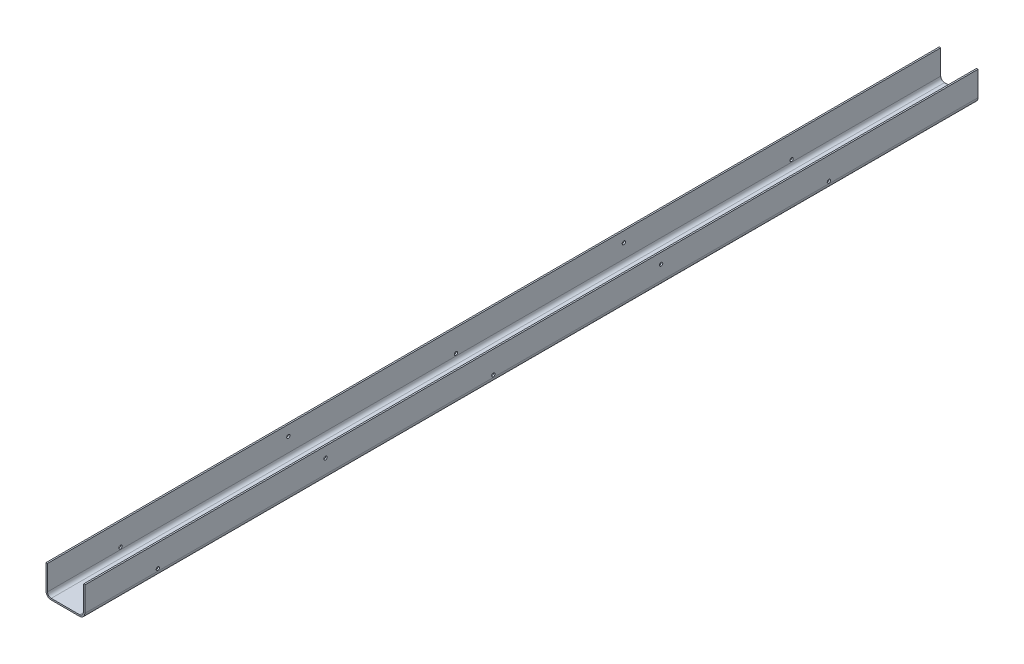
from build123d import *

# Parameters (mm, degrees)
TABAN_FLAN_1_DEPTH         = 6500
KES_EKSTR_ZYON1_DEPTH      = 6509.271659972
KES_EKSTR_ZYON1_DEPTH_BACK = 6509.271659972
IZIM6_R                    = 11
IZIM6_W                    = 510
IZIM6_H                    = 200


# Sheet-metal steps are written as plain solids
with BuildPart() as part:
    # Çizim1 → Taban-Flanş1 (new body)
    with BuildSketch(Plane.XY):
        with BuildLine():
            Line((0, 0), (0, -165))
            ThreePointArc((0, -165), (7.32233047, -182.67766953), (25, -190))
            Line((25, -190), (215, -190))
            ThreePointArc((215, -190), (232.67766953, -182.67766953), (240, -165))
            Line((240, -165), (240, 0))
            Line((240, 0), (250, 0))
            Line((250, 0), (250, -165))
            ThreePointArc((250, -165), (239.748737342, -189.748737342), (215, -200))
            Line((215, -200), (25, -200))
            ThreePointArc((25, -200), (0.251262658, -189.748737342), (-10, -165))
            Line((-10, -165), (-10, 0))
            Line((-10, 0), (0, 0))
        make_face()
    extrude(amount=TABAN_FLAN_1_DEPTH)

    # Çizim6 → Kes-Ekstrüzyon1 (cut, two sides: drawn at the far end of the back side and taken through both)
    with BuildSketch(Plane(origin=(250, 0, 0), x_dir=(0, 0, -1), z_dir=(1, 0, 0)).offset(-KES_EKSTR_ZYON1_DEPTH_BACK)):
        with Locations((-1000, -150)):
            Circle(IZIM6_R)
        with Locations((-3250, -150)):
            Circle(IZIM6_R)
        with Locations((-5500, -150)):
            Circle(IZIM6_R)
        with Locations((-2125, -70)):
            Circle(IZIM6_R)
        with Locations((-4375, -70)):
            Circle(IZIM6_R)
        with Locations((-6245, -100)):
            Rectangle(IZIM6_W, IZIM6_H)
    extrude(amount=KES_EKSTR_ZYON1_DEPTH + KES_EKSTR_ZYON1_DEPTH_BACK, mode=Mode.SUBTRACT)


solid = part.part
